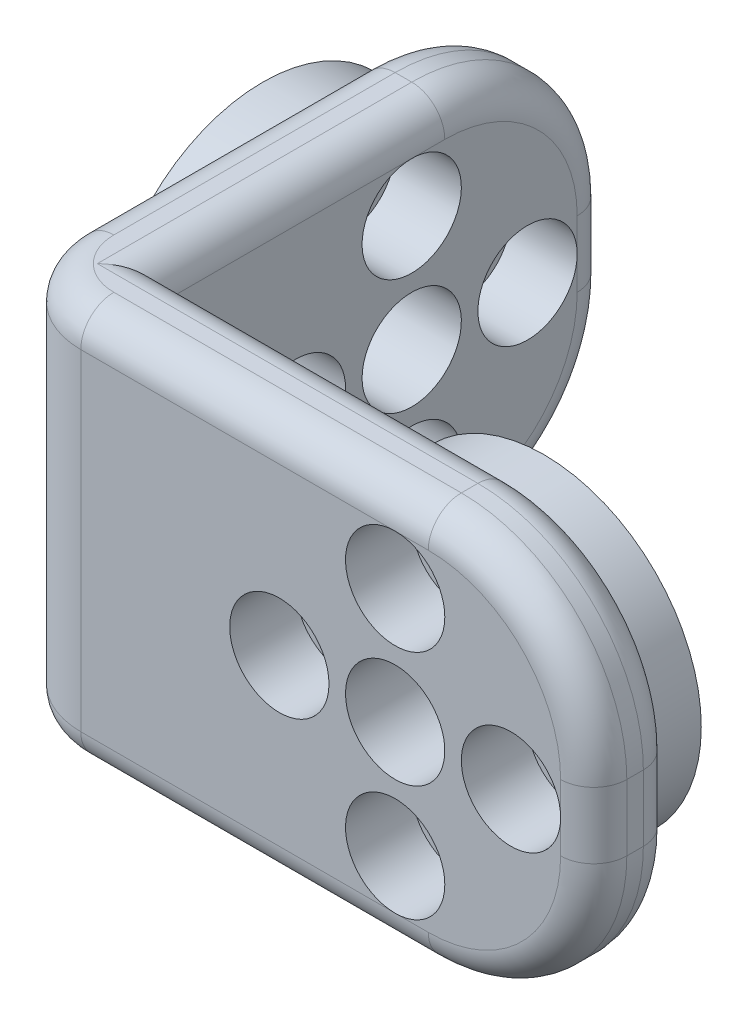
from build123d import *

# Parameters (mm, degrees)
SKETCH_1_W           = 34
SKETCH_1_H           = 20
EXTRUDE_1_DEPTH      = 30
SKETCH_2_W           = 29
SKETCH_2_H           = 20
CUT_EXTRUDE_1_DEPTH  = 25
SKETCH_7_R           = 9.5
EXTRUDE_3_DEPTH      = 4
SKETCH_4_R           = 1.5
CUT_EXTRUDE_5_DEPTH  = 5
SKETCH_6_R           = 9.5
EXTRUDE_2_DEPTH      = 4
SKETCH_5_R           = 1.5
CUT_EXTRUDE_6_DEPTH  = 10
SKETCH_9_R           = 3
CUT_EXTRUDE_7_DEPTH  = 10
SKETCH_10_R          = 3
CUT_EXTRUDE_8_DEPTH  = 10
EXTRUDE_4_DEPTH      = 2
EXTRUDE_5_DEPTH      = 2
SKETCH_14_W          = 5
SKETCH_14_H          = 24
EXTRUDE_6_DEPTH      = 2
SKETCH_15_W          = 5
SKETCH_15_H          = 24
EXTRUDE_7_DEPTH      = 2
SKETCH_16_R          = 3
CUT_EXTRUDE_10_DEPTH = 4
SKETCH_17_R          = 3
CUT_EXTRUDE_11_DEPTH = 4
FILLET_5_R           = 10
FILLET_6_R           = 10
FILLET_9_R           = 10
FILLET_10_R          = 10
FILLET_11_R          = 5
FILLET_12_R          = 2
FILLET_13_R          = 2
FILLET_14_R          = 2


with BuildPart() as part:
    # 草图1 → 凸台-拉伸1 (new body)
    with BuildSketch(Plane.XY):
        with Locations((4.298701299, 4.025974026)):
            Rectangle(SKETCH_1_W, SKETCH_1_H)
    extrude(amount=EXTRUDE_1_DEPTH)

    # 草图2 → 切除-拉伸1 (cut)
    with BuildSketch(Plane(origin=(0, 0, 0), x_dir=(-1, 0, 0), z_dir=(0, 0, -1))):
        with Locations((-6.798701299, 4.025974026)):
            Rectangle(SKETCH_2_W, SKETCH_2_H)
    extrude(amount=-CUT_EXTRUDE_1_DEPTH, mode=Mode.SUBTRACT)

    # 草图7 → 凸台-拉伸3 (add)
    with BuildSketch(Plane.ZY.offset(12.701298701)):
        with Locations((10, 4.025974026)):
            Circle(SKETCH_7_R)
    extrude(amount=EXTRUDE_3_DEPTH)

    # 草图4 → 切除-拉伸5 (cut, symmetric)
    with BuildSketch(Plane.ZY.offset(12.701298701)):
        with Locations((10, 11.025974026)):
            Circle(SKETCH_4_R)
        with Locations((3, 4.025974026)):
            Circle(SKETCH_4_R)
        with Locations((10, -2.974025974)):
            Circle(SKETCH_4_R)
        with Locations((17, 4.025974026)):
            Circle(SKETCH_4_R)
    extrude(amount=CUT_EXTRUDE_5_DEPTH, both=True, mode=Mode.SUBTRACT)

    # 草图6 → 凸台-拉伸2 (add)
    with BuildSketch(Plane(origin=(0, 0, 25), x_dir=(-1, 0, 0), z_dir=(0, 0, -1))):
        with Locations((-11.298701299, 4.025974026)):
            Circle(SKETCH_6_R)
    extrude(amount=EXTRUDE_2_DEPTH)

    # 草图5 → 切除-拉伸6 (cut)
    with BuildSketch(Plane.XY.offset(30)):
        with Locations((11.298701299, 11.025974026)):
            Circle(SKETCH_5_R)
        with Locations((11.298701299, -2.974025974)):
            Circle(SKETCH_5_R)
        with Locations((4.298701299, 4.025974026)):
            Circle(SKETCH_5_R)
        with Locations((18.298701299, 4.025974026)):
            Circle(SKETCH_5_R)
    extrude(amount=-CUT_EXTRUDE_6_DEPTH, mode=Mode.SUBTRACT)

    # 草图9 → 切除-拉伸7 (cut)
    with BuildSketch(Plane(origin=(0, 0, 21), x_dir=(-1, 0, 0), z_dir=(0, 0, -1))):
        with Locations((-11.298701299, 4.025974026)):
            Circle(SKETCH_9_R)
    extrude(amount=-CUT_EXTRUDE_7_DEPTH, mode=Mode.SUBTRACT)

    # 草图10 → 切除-拉伸8 (cut)
    with BuildSketch(Plane.ZY.offset(16.701298701)):
        with Locations((10, 4.025974026)):
            Circle(SKETCH_10_R)
    extrude(amount=-CUT_EXTRUDE_8_DEPTH, mode=Mode.SUBTRACT)

    # 草图12 → 凸台-拉伸4 (add)
    with BuildSketch(Plane(origin=(0, 14.025974026, 0), x_dir=(1, 0, 0), z_dir=(0, 1, 0))):
        Polygon((21.298701299, -25), (-7.701298701, -25), (-7.701298701, 0), (-12.701298701, 0), (-12.701298701, -30), (21.298701299, -30), align=None)
    extrude(amount=EXTRUDE_4_DEPTH)

    # 草图13 → 凸台-拉伸5 (add)
    with BuildSketch(Plane.XZ.offset(5.974025974)):
        Polygon((-7.701298701, 25), (21.298701299, 25), (21.298701299, 30), (-12.701298701, 30), (-12.701298701, 0), (-7.701298701, 0), align=None)
    extrude(amount=EXTRUDE_5_DEPTH)

    # 草图14 → 凸台-拉伸6 (add)
    with BuildSketch(Plane(origin=(21.298701299, 0, 0), x_dir=(0, 0, -1), z_dir=(1, 0, 0))):
        with Locations((-27.5, 4.025974026)):
            Rectangle(SKETCH_14_W, SKETCH_14_H)
    extrude(amount=EXTRUDE_6_DEPTH)

    # 草图15 → 凸台-拉伸7 (add)
    with BuildSketch(Plane(origin=(0, 0, 0), x_dir=(-1, 0, 0), z_dir=(0, 0, -1))):
        with Locations((10.201298701, 4.025974026)):
            Rectangle(SKETCH_15_W, SKETCH_15_H)
    extrude(amount=EXTRUDE_7_DEPTH)

    # 草图16 → 切除-拉伸10 (cut)
    with BuildSketch(Plane.XY.offset(30)):
        with Locations((11.298701299, 11.025974026)):
            Circle(SKETCH_16_R)
        with Locations((4.298701299, 4.025974026)):
            Circle(SKETCH_16_R)
        with Locations((11.298701299, -2.974025974)):
            Circle(SKETCH_16_R)
        with Locations((18.298701299, 4.025974026)):
            Circle(SKETCH_16_R)
    extrude(amount=-CUT_EXTRUDE_10_DEPTH, mode=Mode.SUBTRACT)

    # 草图17 → 切除-拉伸11 (cut)
    with BuildSketch(Plane(origin=(-7.701298701, 0, 0), x_dir=(0, 0, -1), z_dir=(1, 0, 0))):
        with Locations(Location((-10, 11.025974026, 0), (0, 0, 90))):
            Circle(SKETCH_17_R)
        with Locations(Location((-17, 4.025974026, 0), (0, 0, 90))):
            Circle(SKETCH_17_R)
        with Locations(Location((-10, -2.974025974, 0), (0, 0, 90))):
            Circle(SKETCH_17_R)
        with Locations(Location((-3, 4.025974026, 0), (0, 0, 90))):
            Circle(SKETCH_17_R)
    extrude(amount=-CUT_EXTRUDE_11_DEPTH, mode=Mode.SUBTRACT)

    # 圆角5
    fillet_5_edges = [part.edges().sort_by_distance(p)[0] for p in [
        (-10.201298701, 16.025974026, -2),
    ]]
    fillet(fillet_5_edges, radius=FILLET_5_R)

    # 圆角6
    fillet_6_edges = [part.edges().sort_by_distance(p)[0] for p in [
        (-10.201298701, -7.974025974, -2),
    ]]
    fillet(fillet_6_edges, radius=FILLET_6_R)

    # 圆角9
    fillet_9_edges = [part.edges().sort_by_distance(p)[0] for p in [
        (23.298701299, -7.974025974, 27.5),
    ]]
    fillet(fillet_9_edges, radius=FILLET_9_R)

    # 圆角10
    fillet_10_edges = [part.edges().sort_by_distance(p)[0] for p in [
        (23.298701299, 16.025974026, 27.5),
    ]]
    fillet(fillet_10_edges, radius=FILLET_10_R)

    # 圆角11
    fillet_11_edges = [part.edges().sort_by_distance(p)[0] for p in [
        (-12.701298701, 4.025974026, 30),
    ]]
    fillet(fillet_11_edges, radius=FILLET_11_R)

    # 圆角12
    fillet_12_edges = [part.edges().sort_by_distance(p)[0] for p in [
        (-12.701298701, 16.025974026, 16.5),
        (-12.701298701, 13.097041838, 0.928932188),
        (-12.701298701, 4.025974026, -2),
        (-12.701298701, -5.045093786, 0.928932188),
        (2.798701299, -7.974025974, 30),
        (20.369769111, -5.045093786, 30),
        (23.298701299, 4.025974026, 30),
        (20.369769111, 13.097041838, 30),
        (2.798701299, 16.025974026, 30),
        (-12.701298701, -7.974025974, 16.5),
        (-11.236832607, -7.974025974, 28.535533906),
        (-11.236832607, 16.025974026, 28.535533906),
    ]]
    fillet(fillet_12_edges, radius=FILLET_12_R - 0.0001)  # a hair under: the kernel refuses the full size

    # 圆角13
    fillet_13_edges = [part.edges().sort_by_distance(p)[0] for p in [
        (2.798701299, -7.974025974, 25),
        (23.298701299, 4.025974026, 25),
        (20.369769111, -5.045093786, 25),
        (2.798701299, 16.025974026, 25),
        (20.369769111, 13.097041838, 25),
    ]]
    fillet(fillet_13_edges, radius=FILLET_13_R)

    # 圆角14
    fillet_14_edges = [part.edges().sort_by_distance(p)[0] for p in [
        (-7.701298701, 16.025974026, 17.5),
        (-7.701298701, 13.097041838, 0.928932188),
        (-7.701298701, 4.025974026, -2),
        (-7.701298701, -5.045093786, 0.928932188),
        (-7.701298701, -7.974025974, 17.5),
    ]]
    fillet(fillet_14_edges, radius=FILLET_14_R - 0.0001)  # a hair under: the kernel refuses the full size


solid = part.part
